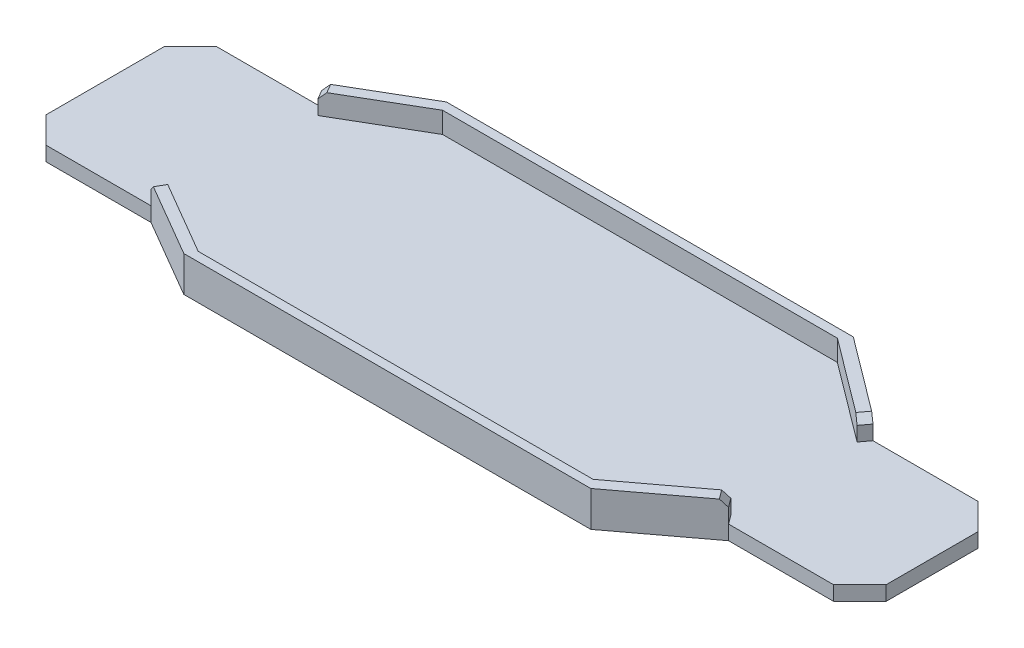
from build123d import *

# Parameters (mm, degrees)
BOSS_EXTRUDE1_DEPTH  = 5.5
CHASSIS_WALLS1_DEPTH = 8
CHAMFER1_SIZE        = 10
CHAMFER2_SIZE        = 10
CHAMFER3_SIZE        = 2.5


with BuildPart() as part:
    # Sketch1 → Boss-Extrude1 (new body)
    with BuildSketch(Plane(origin=(0, 0, 0), x_dir=(1, 0, 0), z_dir=(0, 1, 0))):
        Polygon((-107.5, 32.5), (-77.5, 50), (77.5, 50), (107.5, 27.5), (157.5, 27.5), (157.5, -27.5), (107.5, -27.5), (77.5, -50), (-77.5, -50), (-107.5, -32.5), (-157.5, -32.5), (-157.5, 32.5), align=None)
    extrude(amount=BOSS_EXTRUDE1_DEPTH)

    # Sketch3 → Chassis-Walls1 (add)
    with BuildSketch(Plane(origin=(0, 5.5, 0), x_dir=(1, 0, 0), z_dir=(0, 1, 0))):
        Polygon((0, 50), (-77.5, 50), (-107.5, 32.5), (-105.484515898, 29.044884396), (-75.484515898, 46.544884396), (0, 46.544884396), (74.908663297, 46.544884396), (104.908663297, 24.044884396), (107.5, 27.5), (77.5, 50), align=None)
        Polygon((74.908663297, -46.544884396), (0, -46.544884396), (-75.484515898, -46.544884396), (-105.484515898, -29.044884396), (-107.5, -32.5), (-77.5, -50), (0, -50), (77.5, -50), (107.5, -27.5), (104.908663297, -24.044884396), align=None)
    extrude(amount=CHASSIS_WALLS1_DEPTH)

    # Chamfer1
    chamfer1_edges = [part.edges().sort_by_distance(p)[0] for p in [
        (-157.5, 2.75, -32.5),
        (-157.5, 2.75, 32.5),
    ]]
    chamfer(chamfer1_edges, length=CHAMFER1_SIZE)

    # Chamfer2
    chamfer2_edges = [part.edges().sort_by_distance(p)[0] for p in [
        (157.5, 2.75, -27.5),
        (157.5, 2.75, 27.5),
    ]]
    chamfer(chamfer2_edges, length=CHAMFER2_SIZE)

    # Chamfer3
    chamfer3_edges = [part.edges().sort_by_distance(p)[0] for p in [
        (-106.492257949, 13.5, -30.772442198),
        (-106.492257949, 13.5, 30.772442198),
        (106.204331649, 13.5, 25.772442198),
        (106.204331649, 13.5, -25.772442198),
    ]]
    chamfer(chamfer3_edges, length=CHAMFER3_SIZE)


solid = part.part
